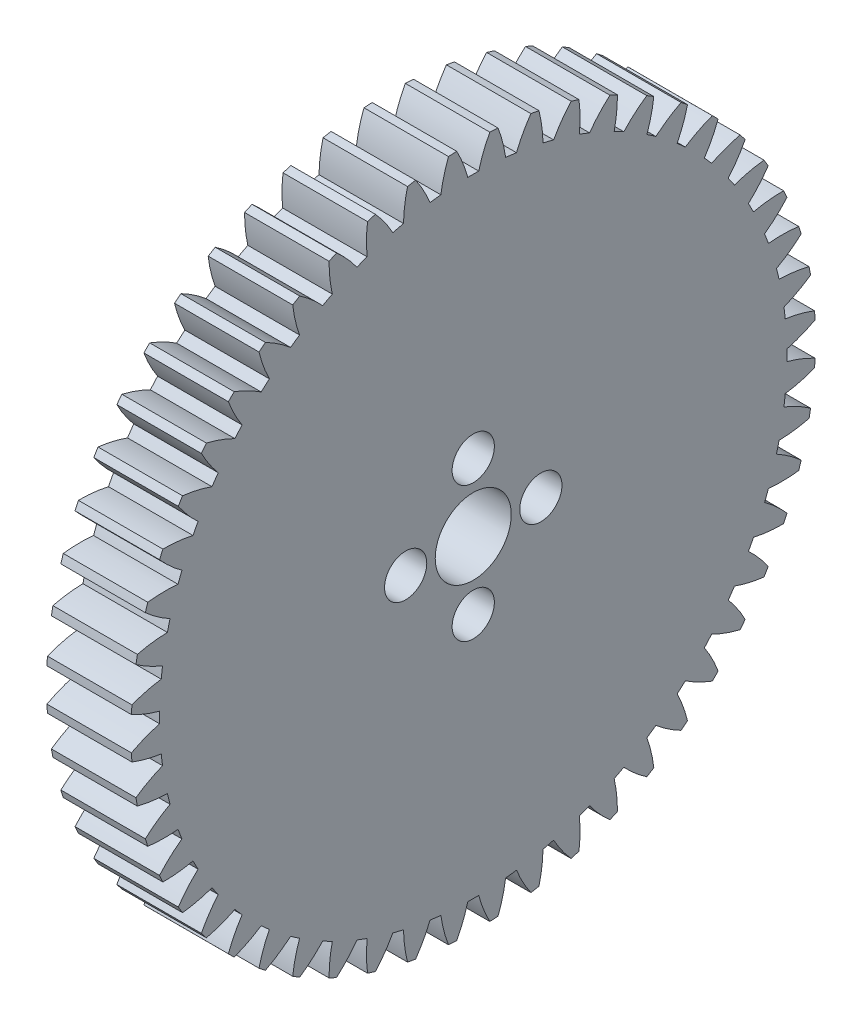
from build123d import *

# Parameters (mm, degrees)
BASPROSKE_W             = 10
BASPROSKE_H             = 40.5
TOOTHCUT_DEPTH          = 59.142067387
TEETHCUTS_COUNT         = 52
BORSKE_R                = 4.5
BORE_DEPTH              = 50.0000508
ENL_V_MAT_EXTRU_1_REACH = 60.076
ESQUISSE2_R             = 1.125
BOSS_EXTRU_1_START      = 13
ESQUISSE3_R             = 15
ESQUISSE3_R_2           = 1.125
ESQUISSE3_R_3           = 4.5
BOSS_EXTRU_1_DEPTH      = 13
ESQUISSE4_R             = 2.5
ENL_V_MAT_EXTRU_2_DEPTH = 14
ESQUISSE6_R             = 35
ESQUISSE6_R_2           = 15
ENL_V_MAT_EXTRU_4_DEPTH = 6
ESQUISSE5_R             = 15
ESQUISSE5_R_2           = 10.5
ENL_V_MAT_EXTRU_3_DEPTH = 5
CHANFREIN1_SIZE         = 4.5
TOOTH_COUNT_DEPTH       = 1.5


with BuildPart() as part:
    # BasProSke → Base-Revolve (revolve)
    with BuildSketch(Plane(origin=(0, 0, 0), x_dir=(1, 0, 0), z_dir=(0, 1, 0)), mode=Mode.PRIVATE) as base_revolve_sk:
        with Locations((5, 20.25)):
            Rectangle(BASPROSKE_W, BASPROSKE_H)
    revolve(base_revolve_sk.sketch.rotate(Axis((-10, 0, 0), (1, 0, 0)), 180), axis=Axis((-10, 0, 0), (1, 0, 0)))

    # TooCutSke → ToothCut (cut, through all)
    with BuildSketch(Plane(origin=(0, 0, 0), x_dir=(0, 0, -1), z_dir=(1, 0, 0))):
        with BuildLine():
            ThreePointArc((0.64738168, 37.118354933), (0, 37.124), (-0.64738168, 37.118354933))
            ThreePointArc((-0.64738168, 37.118354933), (-1.213368508, 38.836346832), (-1.974416987, 40.477274151))
            ThreePointArc((-1.974416987, 40.477274151), (0, 40.5254), (1.974416987, 40.477274151))
            ThreePointArc((1.974416987, 40.477274151), (1.213368508, 38.836346832), (0.64738168, 37.118354933))
        make_face()
    toothcut = extrude(amount=TOOTHCUT_DEPTH, mode=Mode.SUBTRACT)

    # TeethCuts: ToothCut ×52 about axis
    teethcuts_axis = Axis((0, 0, 0), (1, 0, 0))
    for i in range(1, TEETHCUTS_COUNT):
        add(toothcut.rotate(teethcuts_axis, i * 360 / TEETHCUTS_COUNT), mode=Mode.SUBTRACT)

    # BorSke → Bore (cut, symmetric)
    with BuildSketch(Plane(origin=(0, 0, 0), x_dir=(0, 0, -1), z_dir=(1, 0, 0))):
        with Locations(Location((0, 0, 0), (0, 0, 180))):
            Circle(BORSKE_R)
    extrude(amount=BORE_DEPTH, both=True, mode=Mode.SUBTRACT)

    # Esquisse2 → Enlèv. mat.-Extru.1 (cut, up to next)
    with BuildSketch(Plane.ZY, mode=Mode.PRIVATE) as enl_v_mat_extru_1_sk1:
        with Locations((8, 0)):
            Circle(ESQUISSE2_R)
    enl_v_mat_extru_1_tool1 = extrude(enl_v_mat_extru_1_sk1.sketch, amount=-ENL_V_MAT_EXTRU_1_REACH, mode=Mode.PRIVATE) & part.part
    # Esquisse2 → Enlèv. mat.-Extru.1 (cut, up to next)
    with BuildSketch(Plane.ZY, mode=Mode.PRIVATE) as enl_v_mat_extru_1_sk2:
        with Locations((0, -8)):
            Circle(ESQUISSE2_R)
    enl_v_mat_extru_1_tool2 = extrude(enl_v_mat_extru_1_sk2.sketch, amount=-ENL_V_MAT_EXTRU_1_REACH, mode=Mode.PRIVATE) & part.part
    # Esquisse2 → Enlèv. mat.-Extru.1 (cut, up to next)
    with BuildSketch(Plane.ZY, mode=Mode.PRIVATE) as enl_v_mat_extru_1_sk3:
        with Locations((-8, 0)):
            Circle(ESQUISSE2_R)
    enl_v_mat_extru_1_tool3 = extrude(enl_v_mat_extru_1_sk3.sketch, amount=-ENL_V_MAT_EXTRU_1_REACH, mode=Mode.PRIVATE) & part.part
    # Esquisse2 → Enlèv. mat.-Extru.1 (cut, up to next)
    with BuildSketch(Plane.ZY, mode=Mode.PRIVATE) as enl_v_mat_extru_1_sk4:
        with Locations((0, 8)):
            Circle(ESQUISSE2_R)
    enl_v_mat_extru_1_tool4 = extrude(enl_v_mat_extru_1_sk4.sketch, amount=-ENL_V_MAT_EXTRU_1_REACH, mode=Mode.PRIVATE) & part.part
    add(enl_v_mat_extru_1_tool1.solids().sort_by_distance((0, 0, 8))[0], mode=Mode.SUBTRACT)
    add(enl_v_mat_extru_1_tool2.solids().sort_by_distance((0, -8, 0))[0], mode=Mode.SUBTRACT)
    add(enl_v_mat_extru_1_tool3.solids().sort_by_distance((0, 0, -8))[0], mode=Mode.SUBTRACT)
    add(enl_v_mat_extru_1_tool4.solids().sort_by_distance((0, 8, 0))[0], mode=Mode.SUBTRACT)

    # Esquisse3 → Boss.-Extru.1 (add)
    with BuildSketch(Plane.ZY.offset(BOSS_EXTRU_1_START)):
        with Locations(Location((0, 0, 0), (0, 0, 180))):
            Circle(ESQUISSE3_R)
        with Locations((0, -8)):
            Circle(ESQUISSE3_R_2, mode=Mode.SUBTRACT)
        with Locations((8, 0)):
            Circle(ESQUISSE3_R_2, mode=Mode.SUBTRACT)
        with Locations((0, 8)):
            Circle(ESQUISSE3_R_2, mode=Mode.SUBTRACT)
        with Locations((-8, 0)):
            Circle(ESQUISSE3_R_2, mode=Mode.SUBTRACT)
        Circle(ESQUISSE3_R_3, mode=Mode.SUBTRACT)
    extrude(amount=-BOSS_EXTRU_1_DEPTH)

    # Esquisse4 → Enlèv. mat.-Extru.2 (cut)
    with BuildSketch(Plane(origin=(10, 0, 0), x_dir=(0, 0, -1), z_dir=(1, 0, 0))):
        with Locations((0, 8)):
            Circle(ESQUISSE4_R)
        with Locations((8, 0)):
            Circle(ESQUISSE4_R)
        with Locations((0, -8)):
            Circle(ESQUISSE4_R)
        with Locations((-8, 0)):
            Circle(ESQUISSE4_R)
    extrude(amount=-ENL_V_MAT_EXTRU_2_DEPTH, mode=Mode.SUBTRACT)

    # Esquisse6 → Enlèv. mat.-Extru.4 (cut)
    with BuildSketch(Plane.ZY):
        Circle(ESQUISSE6_R)
        with Locations(Location((0, 0, 0), (0, 0, 180))):
            Circle(ESQUISSE6_R_2, mode=Mode.SUBTRACT)
    extrude(amount=-ENL_V_MAT_EXTRU_4_DEPTH, mode=Mode.SUBTRACT)

    # Esquisse5 → Enlèv. mat.-Extru.3 (cut)
    with BuildSketch(Plane.ZY.offset(13)):
        with Locations(Location((0, 0, 0), (0, 0, 180))):
            Circle(ESQUISSE5_R)
        Circle(ESQUISSE5_R_2, mode=Mode.SUBTRACT)
    extrude(amount=-ENL_V_MAT_EXTRU_3_DEPTH, mode=Mode.SUBTRACT)

    # Chanfrein1
    chanfrein1_edges = [part.edges().sort_by_distance(p)[0] for p in [
        (-8, 0, 15),
    ]]
    chamfer(chanfrein1_edges, length=CHANFREIN1_SIZE - 0.0001)  # a hair under: the kernel refuses the full size

    # Esquisse7 → Tooth count (cut)
    with BuildSketch(Plane.ZY.offset(-6)):
        with BuildLine():
            Line((-28.576592548, 3.35), (-25.68525641, 3.35))
            Line((-25.68525641, 3.35), (-25.68525641, 2.291666667))
            Line((-25.68525641, 2.291666667), (-27.673447516, 2.291666667))
            Line((-27.673447516, 2.291666667), (-27.921494391, 1.090865385))
            add(Edge.make_bspline(
                [(-27.921494391, 1.090865385), (-27.887694454, 1.100279094), (-27.821034032, 1.118844863), (-27.720610025, 1.13746398), (-27.623285167, 1.1495323), (-27.559421189, 1.151142053), (-27.528435497, 1.151923077)],
                knots=[0, 0, 0, 0, 1.05461699, 2.079921384, 3.068411212, 4, 4, 4, 4], degree=3))
            add(Edge.make_bspline(
                [(-27.528435497, 1.151923077), (-27.460914427, 1.150375871), (-27.327815523, 1.147325987), (-27.133108717, 1.118372637), (-26.946665448, 1.072771989), (-26.769056253, 1.007736056), (-26.600454633, 0.92309011), (-26.440656209, 0.820692244), (-26.289464855, 0.700362609), (-26.149566366, 0.562025869), (-26.021021791, 0.410128996), (-25.909259614, 0.245836455), (-25.813807741, 0.071490899), (-25.737888621, -0.113991401), (-25.677966779, -0.309445491), (-25.634665918, -0.514996625), (-25.609059956, -0.730888411), (-25.605607149, -0.878175941), (-25.603846154, -0.953295272)],
                knots=[0, 0, 0, 0, 1.01440847, 1.999622559, 2.951875003, 3.895578053, 4.836219714, 5.782137149, 6.743708247, 7.735272588, 8.734977101, 9.730283169, 10.717124674, 11.717316708, 12.737475749, 13.78628267, 14.87096371, 16, 16, 16, 16], degree=3))
            add(Edge.make_bspline(
                [(-25.603846154, -0.953295272), (-25.605998118, -1.029267382), (-25.610244571, -1.179182563), (-25.63794879, -1.399610908), (-25.686847234, -1.610731499), (-25.754014139, -1.813109503), (-25.842502236, -2.005257488), (-25.948921285, -2.189165966), (-26.075070542, -2.363469841), (-26.219712053, -2.526382288), (-26.376956349, -2.675287391), (-26.544384405, -2.806279497), (-26.720819989, -2.916508292), (-26.906267358, -3.005591794), (-27.099662542, -3.076073075), (-27.301064238, -3.127380084), (-27.511451233, -3.156801802), (-27.654276666, -3.16079223), (-27.726872997, -3.162820513)],
                knots=[0, 0, 0, 0, 1.06808661, 2.107647099, 3.116961351, 4.110378221, 5.100014249, 6.085620622, 7.093190682, 8.119403071, 9.144090782, 10.133780668, 11.103064255, 12.062861538, 13.020824475, 13.992378307, 14.979551724, 16, 16, 16, 16], degree=3))
            add(Edge.make_bspline(
                [(-27.726872997, -3.162820513), (-27.791793734, -3.161161251), (-27.919831014, -3.15788884), (-28.108424306, -3.137774875), (-28.290249183, -3.102213196), (-28.464340353, -3.050746239), (-28.632529545, -2.987402164), (-28.792872446, -2.908178427), (-28.946250166, -2.814583555), (-29.092227172, -2.708325658), (-29.228431543, -2.588630257), (-29.352744461, -2.457603018), (-29.465918532, -2.316895475), (-29.565532007, -2.164771725), (-29.651272628, -2.001456521), (-29.727309161, -1.828874572), (-29.789545824, -1.645223571), (-29.821129138, -1.517906493), (-29.837179487, -1.453205128)],
                knots=[0, 0, 0, 0, 1.054957082, 2.080596141, 3.077793124, 4.061112343, 5.027190972, 5.994718051, 6.962465889, 7.943658696, 8.924948258, 9.904494768, 10.875059, 11.855380583, 12.854004648, 13.869083016, 14.917087635, 16, 16, 16, 16], degree=3))
            Line((-29.837179487, -1.453205128), (-28.534615385, -1.453205128))
            add(Edge.make_bspline(
                [(-28.534615385, -1.453205128), (-28.510804481, -1.498040539), (-28.464530708, -1.585173044), (-28.376507762, -1.700854537), (-28.277971661, -1.799502744), (-28.169811256, -1.88208148), (-28.051325734, -1.943948064), (-27.927343157, -1.990864819), (-27.796305983, -2.017976274), (-27.707063882, -2.021365475), (-27.661999199, -2.023076923)],
                knots=[0, 0, 0, 0, 1.104910296, 2.147267069, 3.153527244, 4.136738762, 5.099945312, 6.05603338, 7.018353, 8, 8, 8, 8], degree=3))
            add(Edge.make_bspline(
                [(-27.661999199, -2.023076923), (-27.630589719, -2.021895153), (-27.568791038, -2.01957), (-27.477740454, -2.00726936), (-27.390828671, -1.983972226), (-27.307409522, -1.951711111), (-27.22725892, -1.911477856), (-27.151525853, -1.860685994), (-27.078892702, -1.802222677), (-27.010465238, -1.735135824), (-26.948489679, -1.660349587), (-26.894143892, -1.579986676), (-26.845551265, -1.495832775), (-26.809557963, -1.404554334), (-26.780082492, -1.308876961), (-26.758375563, -1.208078932), (-26.745403225, -1.102042523), (-26.744202334, -1.029654439), (-26.743589744, -0.992728365)],
                knots=[0, 0, 0, 0, 0.978869489, 1.925942215, 2.855067702, 3.774946051, 4.70828698, 5.642468714, 6.60995405, 7.609372294, 8.622401667, 9.629904756, 10.629323, 11.642352373, 12.678539694, 13.745912462, 14.850161547, 16, 16, 16, 16], degree=3))
            add(Edge.make_bspline(
                [(-26.743589744, -0.992728365), (-26.744300725, -0.95665943), (-26.745684668, -0.886450371), (-26.757132917, -0.783358323), (-26.777613615, -0.685542628), (-26.805518742, -0.592254089), (-26.841240635, -0.504059199), (-26.884895177, -0.42043298), (-26.936668863, -0.341798133), (-26.996839657, -0.269755584), (-27.061005172, -0.20367611), (-27.129939553, -0.145883528), (-27.203021739, -0.097919698), (-27.277980789, -0.056045879), (-27.357808801, -0.025571026), (-27.440710762, -0.00458412), (-27.52659949, 0.010815228), (-27.585182328, 0.011719996), (-27.614933894, 0.012179487)],
                knots=[0, 0, 0, 0, 1.166249705, 2.270133367, 3.348514167, 4.393962215, 5.415026464, 6.420877785, 7.440098956, 8.453121383, 9.451844239, 10.415694839, 11.355045125, 12.27538808, 13.187007209, 14.108269027, 15.039275622, 16, 16, 16, 16], degree=3))
            add(Edge.make_bspline(
                [(-27.614933894, 0.012179487), (-27.64725101, 0.010953232), (-27.712021444, 0.008495554), (-27.808254098, -0.011501917), (-27.903326453, -0.043865325), (-27.99776721, -0.088515777), (-28.09063888, -0.146949129), (-28.184392394, -0.215484752), (-28.275889618, -0.299102409), (-28.334066099, -0.36138103), (-28.36416266, -0.39359976)],
                knots=[0, 0, 0, 0, 0.88288272, 1.769486374, 2.674910571, 3.623812639, 4.617874466, 5.670434592, 6.794841017, 8, 8, 8, 8], degree=3))
            Line((-28.36416266, -0.39359976), (-29.323277244, -0.17353766))
            Line((-29.323277244, -0.17353766), (-28.576592548, 3.35))
        make_face()
        with BuildLine():
            Line((-23.65, 1.233333333), (-24.78974359, 1.233333333))
            add(Edge.make_bspline(
                [(-24.78974359, 1.233333333), (-24.784821212, 1.319548906), (-24.775203181, 1.488008959), (-24.736945087, 1.73270258), (-24.685680552, 1.963911144), (-24.617261226, 2.180825859), (-24.531287866, 2.383367905), (-24.429972788, 2.572227758), (-24.310727622, 2.746411067), (-24.176090297, 2.905077822), (-24.028346585, 3.047419232), (-23.87056379, 3.173628069), (-23.700328412, 3.277772425), (-23.520750791, 3.363473588), (-23.331861504, 3.431944834), (-23.131873363, 3.477723404), (-22.922517973, 3.508725099), (-22.779197255, 3.511437872), (-22.70614984, 3.512820513)],
                knots=[0, 0, 0, 0, 1.199038563, 2.342849363, 3.436047546, 4.486744587, 5.497670872, 6.488682221, 7.459191391, 8.424610317, 9.374430501, 10.305433194, 11.225809216, 12.140057399, 13.06607119, 14.010487599, 14.985989317, 16, 16, 16, 16], degree=3))
            add(Edge.make_bspline(
                [(-22.70614984, 3.512820513), (-22.616485174, 3.510022739), (-22.441438733, 3.504560828), (-22.187082369, 3.45796892), (-21.949541336, 3.380036753), (-21.728988304, 3.271144963), (-21.527300879, 3.132809358), (-21.344512506, 2.96786679), (-21.186150998, 2.772856677), (-21.051212295, 2.555893071), (-20.93909436, 2.326159147), (-20.860526782, 2.088604743), (-20.808885158, 1.84953359), (-20.80337726, 1.688555176), (-20.800641026, 1.608583734)],
                knots=[0, 0, 0, 0, 1.075374347, 2.099382735, 3.09057751, 4.06680945, 5.040638231, 6.016817125, 7.011024321, 8.044445721, 9.0776792, 10.070479129, 11.0414456, 12, 12, 12, 12], degree=3))
            add(Edge.make_bspline(
                [(-20.800641026, 1.608583734), (-20.801706371, 1.560211354), (-20.803850647, 1.4628497), (-20.818760086, 1.315517623), (-20.841127189, 1.165442677), (-20.874851331, 1.012753538), (-20.916908101, 0.857407404), (-20.967929041, 0.698939378), (-21.029097633, 0.538247915), (-21.099393097, 0.373524461), (-21.183255764, 0.204234223), (-21.280902183, 0.027839474), (-21.39492411, -0.15550331), (-21.523944306, -0.346829341), (-21.668589389, -0.545836869), (-21.82956547, -0.751926421), (-22.005018482, -0.965824191), (-22.129542421, -1.108802847), (-22.193519631, -1.182261619)],
                knots=[0, 0, 0, 0, 0.728284026, 1.46585585, 2.227944881, 3.01186502, 3.81876927, 4.650621989, 5.517437689, 6.406905708, 7.346299482, 8.360816762, 9.441613733, 10.596154504, 11.834900912, 13.145207542, 14.533280747, 16, 16, 16, 16], degree=3))
            Line((-22.193519631, -1.182261619), (-22.85625, -1.941666667))
            Line((-22.85625, -1.941666667), (-20.719230769, -1.941666667))
            Line((-20.719230769, -1.941666667), (-20.719230769, -3))
            Line((-20.719230769, -3), (-24.952564103, -3))
            Line((-24.952564103, -3), (-24.952564103, -2.422495994))
            Line((-24.952564103, -2.422495994), (-23.072495994, -0.421584535))
            add(Edge.make_bspline(
                [(-23.072495994, -0.421584535), (-23.01806319, -0.363217327), (-22.912642993, -0.250177353), (-22.762640916, -0.084166125), (-22.626902288, 0.073374567), (-22.508241757, 0.224122215), (-22.400432173, 0.363187178), (-22.308280757, 0.494761048), (-22.230944396, 0.617654349), (-22.146984806, 0.765842206), (-22.067250796, 0.942582597), (-21.994090015, 1.146194773), (-21.949493457, 1.340801121), (-21.943337721, 1.4676108), (-21.940384615, 1.528445513)],
                knots=[0, 0, 0, 0, 1.246127091, 2.413378631, 3.493388633, 4.492180848, 5.408488754, 6.240484944, 6.999099869, 7.674939598, 8.898438119, 10.020720584, 11.050475521, 12, 12, 12, 12], degree=3))
            add(Edge.make_bspline(
                [(-21.940384615, 1.528445513), (-21.942592581, 1.587298404), (-21.946870869, 1.701335317), (-21.993885785, 1.863552217), (-22.066722924, 2.010423062), (-22.169360739, 2.137559183), (-22.293687279, 2.242035364), (-22.437358274, 2.319741812), (-22.599202384, 2.364578077), (-22.712658189, 2.370189975), (-22.771023638, 2.373076923)],
                knots=[0, 0, 0, 0, 1.062038974, 2.057870785, 3.028805853, 4.01125022, 4.991535629, 5.949134679, 6.94496649, 8, 8, 8, 8], degree=3))
            add(Edge.make_bspline(
                [(-22.771023638, 2.373076923), (-22.801175972, 2.37201045), (-22.860535685, 2.369910926), (-22.947789823, 2.355934967), (-23.030818404, 2.331303796), (-23.110545582, 2.298301494), (-23.186120489, 2.254556706), (-23.257352499, 2.200634286), (-23.324992133, 2.137904524), (-23.388729167, 2.066563568), (-23.446738189, 1.98694704), (-23.49826159, 1.899782075), (-23.540862866, 1.805122778), (-23.578370577, 1.704218797), (-23.607298318, 1.59598634), (-23.628361303, 1.481073167), (-23.644374084, 1.359666226), (-23.648090579, 1.27621037), (-23.65, 1.233333333)],
                knots=[0, 0, 0, 0, 0.903469896, 1.778625579, 2.63899355, 3.493148037, 4.358286772, 5.247621495, 6.164656832, 7.118446693, 8.109501108, 9.111810964, 10.146451449, 11.215617525, 12.33435995, 13.498009769, 14.714554818, 16, 16, 16, 16], degree=3))
        make_face()
    extrude(amount=-TOOTH_COUNT_DEPTH, mode=Mode.SUBTRACT)


solid = part.part
